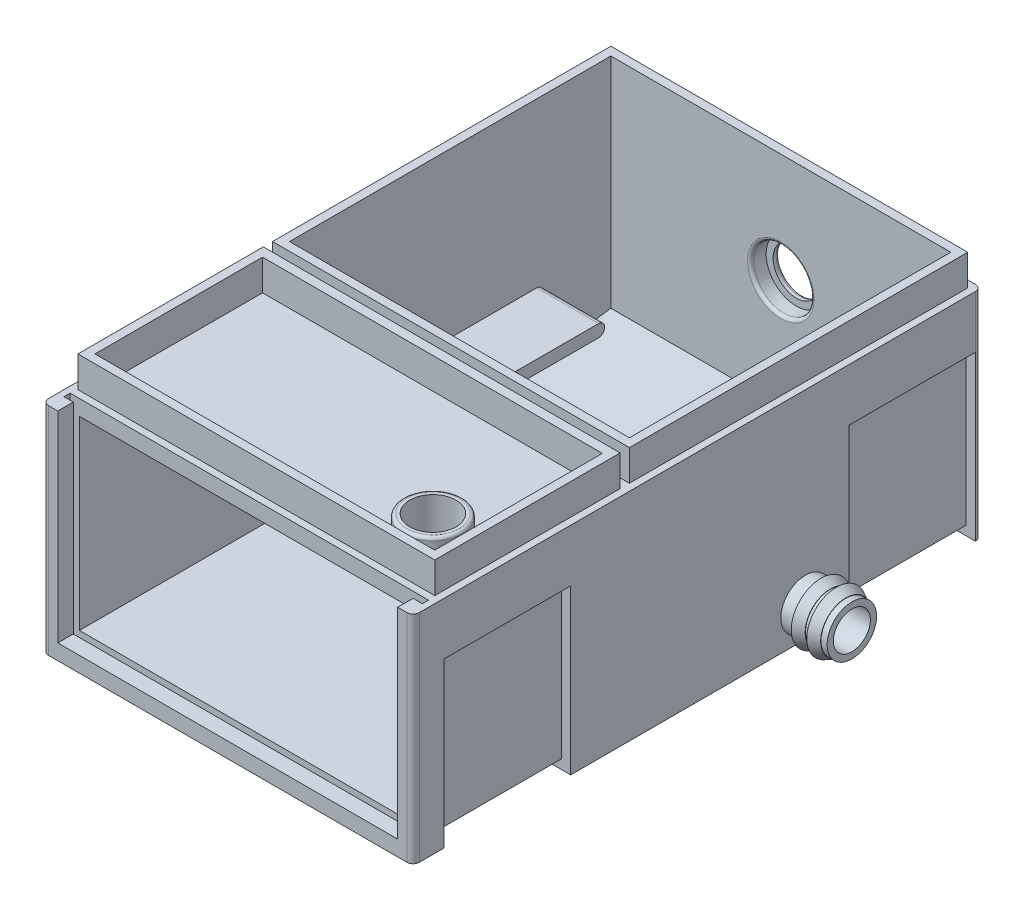
from build123d import *

# Parameters (mm, degrees)
CROQUIS2_W                 = 120
CROQUIS2_H                 = 114
SALIENTE_EXTRUIR1_DEPTH    = 10
CORTAR_EXTRUIR1_DEPTH      = 134.225372959
CORTAR_EXTRUIR1_DEPTH_BACK = 134.225372959
CROQUIS5_W                 = 120
CROQUIS5_H                 = 114
CROQUIS5_W_2               = 110
CROQUIS5_H_2               = 104
SALIENTE_EXTRUIR5_DEPTH    = 80
CROQUIS6_R                 = 8
CORTAR_EXTRUIR2_DEPTH      = 10
SALIENTE_EXTRUIR6_START    = 15
CROQUIS7_R                 = 8
CROQUIS7_R_2               = 6
SALIENTE_EXTRUIR6_DEPTH    = 20
MATRIZL1_OUTLINE_W         = 6
MATRIZL1_OUTLINE_H         = 3
CROQUIS42_R                = 6
CORTAR_EXTRUIR16_DEPTH     = 10
CROQUIS9_R                 = 7.5
CORTAR_EXTRUIR4_DEPTH      = 159.180276899
CROQUIS10_R                = 9.75
CROQUIS10_R_2              = 7.5
CORTAR_EXTRUIR5_DEPTH      = 27
SALIENTE_EXTRUIR7_DEPTH    = 20
CROQUIS13_W                = 120
CROQUIS13_H                = 114
CROQUIS13_W_2              = 115.5
CROQUIS13_H_2              = 109.5
CORTAR_EXTRUIR6_DEPTH      = 10
CROQUIS14_R                = 2.5
SALIENTE_EXTRUIR8_DEPTH    = 2
CROQUIS15_R                = 1
CORTAR_EXTRUIR7_DEPTH      = 5
CROQUIS16_W                = 120
CROQUIS16_H                = 70
CROQUIS16_W_2              = 110
CROQUIS16_H_2              = 60
SALIENTE_EXTRUIR9_DEPTH    = 70
CROQUIS17_W                = 116
CROQUIS17_H                = 2
CORTAR_EXTRUIR8_DEPTH      = 68
REDONDEO1_R                = 2
REDONDEO2_R                = 2
CROQUIS19_R                = 12.5
CROQUIS19_R_2              = 7.5
SALIENTE_EXTRUIR11_DEPTH   = 2
CORTAR_EXTRUIR9_START      = -2
CORTAR_EXTRUIR9_OUTLINE_W  = 0.990232649
CORTAR_EXTRUIR9_OUTLINE_H  = 0.145037793
CORTAR_EXTRUIR9_DEPTH      = 3
CORTAR_EXTRUIR10_DEPTH     = 2
CORTAR_EXTRUIR11_REACH     = 217.919
CROQUIS33_W                = 110
CROQUIS33_H                = 5
CROQUIS34_W                = 41
CROQUIS34_H                = 53
CORTAR_EXTRUIR12_DEPTH     = 3
CROQUIS35_W                = 20
CROQUIS35_H                = 41
CORTAR_EXTRUIR13_DEPTH     = 3
SALIENTE_EXTRUIR16_DEPTH   = 10
CROQUIS38_R                = 7.5
CORTAR_EXTRUIR15_DEPTH     = 10
SALIENTE_EXTRUIR17_START   = 10
CROQUIS39_R                = 9.5
CROQUIS39_R_2              = 7.5
SALIENTE_EXTRUIR17_DEPTH   = 10
REDONDEO3_R                = 1
REDONDEO4_R                = 1
REDONDEO5_R                = 1
CROQUIS43_W                = 115.5
CROQUIS43_H                = 3
CORTAR_EXTRUIR17_DEPTH     = 10
CROQUIS44_W                = 110
CROQUIS44_H                = 3
SALIENTE_EXTRUIR18_DEPTH   = 10


with BuildPart() as part:
    # Croquis2 → Saliente-Extruir1 (new body)
    with BuildSketch(Plane(origin=(0, 0, 0), x_dir=(1, 0, 0), z_dir=(0, 1, 0))):
        Rectangle(CROQUIS2_W, CROQUIS2_H)
    extrude(amount=SALIENTE_EXTRUIR1_DEPTH)

    # Croquis3 → Cortar-Extruir1 (cut, two sides: drawn at the far end of the back side and taken through both)
    with BuildSketch(Plane.ZY.offset(60).offset(-CORTAR_EXTRUIR1_DEPTH_BACK)):
        Polygon((-293.556980837, 43.200979767), (-57, 10), (0, 2), (57, 10), (293.556980837, 43.200979767), (293.556980837, 520.952003796), (-293.556980837, 520.952003796), align=None)
    extrude(amount=CORTAR_EXTRUIR1_DEPTH + CORTAR_EXTRUIR1_DEPTH_BACK, mode=Mode.SUBTRACT)

    # Croquis5 → Saliente-Extruir5 (add)
    with BuildSketch(Plane.XZ):
        Rectangle(CROQUIS5_W, CROQUIS5_H)
        Rectangle(CROQUIS5_W_2, CROQUIS5_H_2, mode=Mode.SUBTRACT)
    extrude(amount=-SALIENTE_EXTRUIR5_DEPTH)

    # Croquis6 → Cortar-Extruir2 (cut)
    with BuildSketch(Plane(origin=(60, 0, 0), x_dir=(0, 0, -1), z_dir=(1, 0, 0))):
        with Locations((0, 10)):
            Circle(CROQUIS6_R)
    extrude(amount=-CORTAR_EXTRUIR2_DEPTH, mode=Mode.SUBTRACT)

    # Croquis7 → Saliente-Extruir6 (add)
    with BuildSketch(Plane(origin=(60, 0, 0), x_dir=(0, 0, -1), z_dir=(1, 0, 0)).offset(SALIENTE_EXTRUIR6_START)):
        with Locations((0, 10)):
            Circle(CROQUIS7_R)
        with Locations((0, 10)):
            Circle(CROQUIS7_R_2, mode=Mode.SUBTRACT)
    extrude(amount=-SALIENTE_EXTRUIR6_DEPTH)

    # Recubrir-Lámina1: read off the stored shape, not the designer's step
    # Recubrir-Lámina1 outline → Recubrir-Lámina1 (revolve)
    with BuildSketch(Plane(origin=(0, 10, 0), x_dir=(0, 1, 0), z_dir=(0, 0, -1))):
        Polygon((8, 68), (8, 65), (9.611803399, 65), (8.111803399, 68), align=None)
    revolve(axis=Axis((0, 10, 0), (1, 0, 0)))

    # MatrizL1: read off the stored shape, not the designer's step
    # MatrizL1 outline → MatrizL1 (revolve)
    with BuildSketch(Plane(origin=(0, 10, 0), x_dir=(0, 1, 0), z_dir=(0, 0, -1))):
        with Locations((3, 71.5)):
            Rectangle(MATRIZL1_OUTLINE_W, MATRIZL1_OUTLINE_H)
        Polygon((8, 73), (8, 70), (9.611803399, 70), (8.111803399, 73), align=None)
    revolve(axis=Axis((0, 10, 0), (1, 0, 0)))

    # Croquis42 → Cortar-Extruir16 (cut)
    with BuildSketch(Plane(origin=(73, 0, 0), x_dir=(0, 0, -1), z_dir=(1, 0, 0))):
        with Locations((0, 10)):
            Circle(CROQUIS42_R)
    extrude(amount=-CORTAR_EXTRUIR16_DEPTH, mode=Mode.SUBTRACT)

    # Croquis9 → Cortar-Extruir4 (cut, through all)
    with BuildSketch(Plane.XY.offset(57)):
        with Locations((0, 44.649122807)):
            Circle(CROQUIS9_R)
    extrude(amount=-CORTAR_EXTRUIR4_DEPTH, mode=Mode.SUBTRACT)

    # Croquis10 → Cortar-Extruir5 (cut)
    with BuildSketch(Plane.XY.offset(-52)):
        with Locations((0, 44.649122807)):
            Circle(CROQUIS10_R)
        with Locations((0, 44.649122807)):
            Circle(CROQUIS10_R_2, mode=Mode.SUBTRACT)
    cortar_extruir5 = extrude(amount=-CORTAR_EXTRUIR5_DEPTH, mode=Mode.SUBTRACT)

    # Simetría1: Cortar-Extruir5 across plane
    add(cortar_extruir5.mirror(Plane.XY), mode=Mode.SUBTRACT)

    # Croquis11 → Saliente-Extruir7 (add)
    with BuildSketch(Plane.ZY.offset(-55)):
        with BuildLine():
            ThreePointArc((28, 23), (30, 25), (28, 27))
            Line((28, 27), (-28, 27))
            ThreePointArc((-28, 27), (-30, 25), (-28, 23))
            Line((-28, 23), (-8.460817995, 23))
            Line((-8.460817995, 23), (28, 23))
        make_face()
    saliente_extruir7 = extrude(amount=SALIENTE_EXTRUIR7_DEPTH)

    # Simetría2: Saliente-Extruir7 across plane
    add(saliente_extruir7.mirror(Plane(origin=(0, 0, 0), x_dir=(0, 0, 1), z_dir=(1, 0, 0))))

    # Croquis13 → Cortar-Extruir6 (cut)
    with BuildSketch(Plane(origin=(0, 80, 0), x_dir=(1, 0, 0), z_dir=(0, 1, 0))):
        Rectangle(CROQUIS13_W, CROQUIS13_H)
        Rectangle(CROQUIS13_W_2, CROQUIS13_H_2, mode=Mode.SUBTRACT)
    extrude(amount=-CORTAR_EXTRUIR6_DEPTH, mode=Mode.SUBTRACT)

    # Croquis14 → Saliente-Extruir8 (add)
    with BuildSketch(Plane.XY.offset(57)):
        with Locations(Location((-45, 60, 0), (0, 0, 180))):
            Circle(CROQUIS14_R)
        with Locations(Location((-45, 10, 0), (0, 0, 180))):
            Circle(CROQUIS14_R)
        with Locations(Location((45, 10, 0), (0, 0, 180))):
            Circle(CROQUIS14_R)
        with Locations(Location((45, 60, 0), (0, 0, 180))):
            Circle(CROQUIS14_R)
    extrude(amount=SALIENTE_EXTRUIR8_DEPTH)

    # Croquis15 → Cortar-Extruir7 (cut)
    with BuildSketch(Plane.XY.offset(59)):
        with Locations((-45, 60)):
            Circle(CROQUIS15_R)
        with Locations((-45, 10)):
            Circle(CROQUIS15_R)
        with Locations((45, 10)):
            Circle(CROQUIS15_R)
        with Locations((45, 60)):
            Circle(CROQUIS15_R)
    extrude(amount=-CORTAR_EXTRUIR7_DEPTH, mode=Mode.SUBTRACT)

    # Croquis16 → Saliente-Extruir9 (add)
    with BuildSketch(Plane.XY.offset(57)):
        with Locations((0, 35)):
            Rectangle(CROQUIS16_W, CROQUIS16_H)
        with Locations((0, 35)):
            Rectangle(CROQUIS16_W_2, CROQUIS16_H_2, mode=Mode.SUBTRACT)
    extrude(amount=SALIENTE_EXTRUIR9_DEPTH)

    # Croquis17 → Cortar-Extruir8 (cut)
    with BuildSketch(Plane(origin=(0, 70, 0), x_dir=(1, 0, 0), z_dir=(0, 1, 0))):
        with Locations((0, -121)):
            Rectangle(CROQUIS17_W, CROQUIS17_H)
    extrude(amount=-CORTAR_EXTRUIR8_DEPTH, mode=Mode.SUBTRACT)

    # Redondeo1
    redondeo1_edges = [part.edges().sort_by_distance(p)[0] for p in [
        (-60, 35, -57),
        (60, 35, -57),
    ]]
    fillet(redondeo1_edges, radius=REDONDEO1_R)

    # Redondeo2
    redondeo2_edges = [part.edges().sort_by_distance(p)[0] for p in [
        (-60, 35, 127),
        (60, 35, 127),
    ]]
    fillet(redondeo2_edges, radius=REDONDEO2_R)

    # Croquis19 → Saliente-Extruir11 (add)
    with BuildSketch(Plane(origin=(0, 0, -57), x_dir=(-1, 0, 0), z_dir=(0, 0, -1))):
        with Locations(Location((0, 44.649122807, 0), (0, 0, 180))):
            Circle(CROQUIS19_R)
        with Locations((0, 44.649122807)):
            Circle(CROQUIS19_R_2, mode=Mode.SUBTRACT)
    saliente_extruir11 = extrude(amount=SALIENTE_EXTRUIR11_DEPTH)

    # Simetría3: Saliente-Extruir11 across plane
    add(saliente_extruir11.mirror(Plane.XY))

    # Cortar-Extruir9: read off the stored shape, not the designer's step
    # Cortar-Extruir9 outline → Cortar-Extruir9 (cut)
    # profile 1 of 2: a face of its own
    with BuildSketch(Plane(origin=(0, 0, -57), x_dir=(-1, 0, 0), z_dir=(0, 0, -1)).offset(CORTAR_EXTRUIR9_START)):
        Polygon((-42.791191374, 27.157045796), (-41.105219056, 25.378799011), (-39.419246739, 23.600306815), (-39.225863014, 21.372467412), (-39.035178809, 19.144628008), (-39.090641654, 19.086465645), (-39.217273636, 18.955416268), (-39.35347664, 18.815777513), (-39.531154072, 18.634173508), (-39.745643126, 18.415267058), (-39.991299355, 18.164457203), (-40.263459952, 17.886897568), (-40.556725879, 17.58749637), (-40.865943509, 17.271898059), (-41.464009672, 16.661070533), (-41.731507463, 16.387192061), (-41.971764654, 16.141045011), (-42.179136795, 15.92778301), (-42.349206491, 15.752559686), (-42.476574706, 15.620283255), (-42.556333221, 15.536352756), (-42.583328411, 15.505676403), (-42.576702319, 15.49561456), (-42.568849173, 15.487516003), (-42.558541919, 15.477208749), (-42.546025967, 15.465429029), (-42.53179214, 15.452176845), (-42.516085847, 15.437697607), (-42.499397912, 15.422482136), (-42.481973744, 15.406530433), (-42.380619076, 15.319655004), (-40.70421778, 17.032622511), (-40.119158391, 17.626762101), (-39.856814227, 17.891805784), (-39.62072902, 18.129118045), (-39.416301809, 18.333545256), (-39.248195399, 18.500670023), (-39.121318006, 18.625093307), (-39.040577847, 18.701906893), (-39.010883138, 18.726447975), (-39.000821295, 18.670003487), (-38.99345897, 18.608650783), (-38.984624181, 18.528401445), (-38.974807748, 18.431464172), (-38.964009672, 18.320047661), (-38.952720774, 18.19660602), (-38.940941055, 18.063102535), (-38.928915925, 17.921991315), (-38.866090756, 17.136676698), (-38.793449154, 17.07139742), (-38.755165066, 17.033358744), (-38.742649114, 17.014952932), (-38.733568914, 16.99335678), (-38.727433644, 16.965870769), (-38.723752481, 16.930531611), (-38.721789195, 16.884394377), (-38.721298373, 16.825004959), (-38.721052962, 16.749909249), (-38.721052962, 16.496399875), (-38.06899642, 16.496399875), (-38.06899642, 17.027959706), (-35.655871849, 17.027959706), (-35.583475658, 16.923905519), (-35.511570288, 16.830649408), (-35.472059147, 16.788438748), (-35.429848486, 16.748927606), (-35.384692896, 16.711870573), (-35.336592375, 16.677022236), (-35.284810693, 16.644137187), (-35.229593259, 16.612970013), (-35.170449252, 16.583275304), (-35.087009574, 16.545482038), (-35.051670416, 16.532720676), (-35.016576669, 16.523149654), (-34.979765046, 16.516523562), (-34.938045207, 16.512106167), (-34.889453865, 16.509652059), (-34.83080068, 16.508670415), (-34.759631543, 16.508425005), (-34.629072988, 16.509652059), (-34.580236235, 16.512351578), (-34.538761807, 16.516768972), (-34.501950184, 16.523640475), (-34.467347259, 16.533456908), (-34.432008101, 16.546709092), (-34.393478603, 16.563887849), (-34.349059245, 16.585729412), (-34.193714197, 16.678494701), (-34.123035882, 16.733712135), (-34.057756604, 16.793837786), (-33.998121776, 16.858871652), (-33.944867628, 16.928322914), (-33.897748751, 17.001700748), (-33.857746788, 17.078514334), (-33.824861738, 17.15827285), (-33.811854965, 17.203673851), (-33.805474284, 17.232632328), (-33.799093602, 17.264535734), (-33.792958332, 17.298402427), (-33.787313883, 17.333741585), (-33.782405667, 17.369326153), (-33.777988272, 17.404665311), (-33.77430711, 17.438532004), (-33.757373763, 17.622344706), (-32.766895703, 16.57591298), (-32.416203645, 16.206324288), (-32.255214148, 16.036745413), (-32.107722247, 15.881645776), (-31.977163692, 15.744461129), (-31.866728824, 15.628381812), (-31.778871751, 15.536843577), (-31.717273636, 15.473036765), (-31.684879408, 15.440397126), (-31.59554987, 15.351067588), (-31.4964039, 15.44751404), (-31.399957448, 15.54666001), (-32.829720872, 17.054464074), (-33.334285514, 17.586760138), (-33.565707915, 17.83069849), (-33.77725204, 18.053531513), (-33.964500493, 18.25084181), (-34.122790471, 18.417475756), (-34.247949988, 18.549015954), (-34.335316239, 18.6407996), (-34.380471829, 18.687918477), (-34.50366806, 18.813568815), (-34.303167422, 20.959195595), (-34.23347075, 21.712606805), (-34.201321933, 22.055200306), (-34.172363456, 22.366135813), (-34.14659532, 22.639032642), (-34.124753757, 22.867510113), (-34.107820411, 23.044942134), (-34.096286103, 23.164948024), (-34.090641654, 23.220901691), (-34.076162416, 23.334526899), (-33.286430404, 23.334526899), (-33.286430404, 23.924003683), (-33.287412047, 24.18119422), (-33.288884512, 24.278622315), (-33.291338621, 24.357644598), (-33.29428355, 24.419488124), (-33.298210123, 24.465870769), (-33.302872929, 24.498019586), (-33.308517378, 24.517407041), (-33.315388881, 24.525751008), (-33.250109603, 24.605754935), (-33.165442871, 24.698274813), (-33.050345198, 24.820734811), (-32.908497745, 24.969699178), (-32.742845443, 25.141732161), (-32.557314865, 25.333398009), (-32.35485094, 25.54077015), (-32.138889421, 25.760412832), (-31.712365419, 26.195771623), (-31.516527587, 26.395536028), (-31.337868512, 26.578612499), (-31.179578534, 26.74107446), (-31.045584228, 26.878749929), (-30.939812165, 26.988203153), (-30.865698098, 27.06526215), (-30.827414011, 27.106245757), (-30.723605235, 27.222325073), (-30.730722149, 27.403438257), (-30.738084473, 27.587250959), (-32.242943607, 26.052942527), (-33.747557331, 24.518388684), (-33.967445423, 24.518388684), (-33.950512077, 24.743184993), (-33.938486947, 24.907119419), (-33.931370033, 24.959146512), (-33.920817368, 24.995467313), (-33.905111076, 25.01853593), (-33.882042459, 25.031297293), (-33.849893642, 25.036941742), (-33.806455927, 25.038168796), (-33.750011439, 25.037923385), (-33.669025869, 25.039886671), (-33.637122463, 25.042831601), (-33.60939104, 25.047248996), (-33.584113726, 25.053875088), (-33.560308877, 25.062955288), (-33.536504027, 25.074735008), (-33.511717535, 25.089705067), (-33.484476934, 25.108110879), (-33.355881666, 25.241614364), (-33.316125113, 25.321127469), (-33.293056496, 25.40554879), (-33.286921226, 25.49266963), (-33.297473891, 25.57979047), (-33.325450724, 25.663966381), (-33.370851725, 25.742743253), (-33.433676895, 25.81366698), (-33.564726271, 25.900296998), (-33.635895409, 25.925574313), (-33.708782421, 25.938335675), (-33.782160256, 25.938826497), (-33.854556447, 25.927292188), (-33.924743941, 25.903241928), (-33.991004862, 25.867166538), (-34.052112155, 25.818575196), (-34.105120892, 25.767775157), (-34.230771231, 25.881400365), (-34.41065736, 26.01195892), (-34.520110585, 26.072329982), (-34.641343529, 26.12901988), (-34.774110781, 26.181537795), (-34.917185288, 26.229883727), (-35.070567049, 26.273321441), (-35.233274421, 26.31185094), (-35.404571172, 26.345226811), (-35.653417741, 26.386210417), (-35.653417741, 26.548181557), (-37.368348535, 26.548181557), (-37.368348535, 26.490264604), (-37.371293465, 26.461060717), (-37.375465449, 26.450508052), (-37.382336952, 26.442164084), (-37.392153384, 26.435292581), (-37.405650979, 26.430138954), (-37.423075147, 26.425476148), (-37.445162121, 26.421549575), (-37.472402722, 26.417623002), (-37.525656869, 26.410506088), (-37.562959314, 26.405597872), (-37.605906207, 26.399708012), (-37.653025084, 26.393327331), (-37.703579712, 26.386455828), (-37.756343038, 26.379093504), (-37.810088007, 26.37197659), (-37.863587565, 26.364614265), (-37.99709105, 26.34792633), (-38.06605149, 26.341791059), (-38.136975216, 26.336637432), (-38.209616818, 26.33295627), (-38.284221707, 26.330256751), (-38.360789882, 26.328538875), (-38.439566754, 26.328048054), (-38.520552324, 26.328293464), (-38.890141016, 26.335655789), (-38.890141016, 26.101043047), (-39.035178809, 26.021529942), (-39.16745524, 25.935881567), (-39.232734517, 25.885081528), (-39.296050508, 25.830600326), (-39.355685337, 25.773665016), (-39.41065736, 25.715502653), (-39.459248702, 25.657340289), (-39.500477719, 25.600159568), (-39.532626536, 25.545432956), (-39.60281403, 25.412420293), (-39.953015267, 25.412420293), (-39.953015267, 25.074244186), (-39.747606413, 25.074244186), (-39.669074951, 25.072771721), (-39.636435312, 25.071053845), (-39.608458479, 25.068599737), (-39.585144451, 25.065654807), (-39.566493229, 25.061973645), (-39.553241045, 25.057801661), (-39.545142488, 25.052893445), (-39.542442969, 25.047739818), (-39.539988861, 25.012155249), (-39.537043931, 24.977061502), (-39.533362769, 24.931905912), (-39.528699963, 24.878160943), (-39.523300925, 24.817053649), (-39.517411066, 24.750056496), (-39.510784974, 24.678151126), (-39.50366806, 24.603055416), (-39.49164293, 24.452618585), (-39.486489303, 24.382921912), (-39.482071908, 24.318133457), (-39.478390746, 24.260216504), (-39.475691227, 24.210398108), (-39.474218762, 24.169905323), (-39.47372794, 24.139965203), (-39.474709583, 24.122295624), (-39.52158305, 24.139719792), (-39.58784397, 24.198372978), (-39.69263439, 24.300218467), (-39.843071221, 24.452618585), (-40.0467622, 24.662935655), (-40.311315061, 24.938777415), (-40.643846719, 25.287751597), (-41.051964909, 25.716975118), (-41.603648427, 26.298353345), (-41.854949104, 26.563151617), (-42.083181165, 26.80414504), (-42.283927214, 27.015934576), (-42.452033624, 27.193612008), (-42.583083001, 27.332023709), (-42.671921717, 27.426261463), (-42.713886966, 27.471171643), (-42.805670612, 27.572771721), (-42.798308288, 27.364908758), align=None)
        Polygon((-36.73666109, 20.76286694), (-36.635061012, 20.657094878), (-36.51161937, 20.528008788), (-36.369771918, 20.379044422), (-36.212218173, 20.213146709), (-36.041657655, 20.03350599), (-35.302725682, 19.252363357), (-35.123575786, 19.058488811), (-34.998661679, 18.916395948), (-34.919148574, 18.814059637), (-34.87595627, 18.740190981), (-34.859513746, 18.682519439), (-34.8607408, 18.629510702), (-34.870802643, 18.569385052), (-34.880864487, 18.522511586), (-34.887981401, 18.505578239), (-34.898043244, 18.492080644), (-34.912031661, 18.480791747), (-34.930928294, 18.470729903), (-34.956205608, 18.461158881), (-34.989090657, 18.450851627), (-35.030319675, 18.439071908), (-35.283338228, 18.329127861), (-35.392791453, 18.251578043), (-35.489483315, 18.161021451), (-35.572432171, 18.058194318), (-35.640410968, 17.945059932), (-35.692683472, 17.822354523), (-35.727777219, 17.691795968), (-35.745201387, 17.554611321), (-35.757226517, 17.366135813), (-38.527914649, 17.366135813), (-38.537485671, 17.421844068), (-38.560554288, 17.639523463), (-38.578960099, 17.844686907), (-38.599820018, 18.084453276), (-38.62117076, 18.336735597), (-38.641049036, 18.578956074), (-38.657491561, 18.789518555), (-38.668535047, 18.946090657), (-38.672707031, 19.026094584), (-38.651601701, 19.084502358), (-38.617735008, 19.131866646), (-38.562026752, 19.198372978), (-38.479568718, 19.289665802), (-38.365452687, 19.410898746), (-38.214525035, 19.567716258), (-38.022368364, 19.765517377), (-37.783829049, 20.009701141), (-37.474366008, 20.324317809), (-37.334972664, 20.464938208), (-37.209813147, 20.591079368), (-37.101096155, 20.700041771), (-37.011275795, 20.788880487), (-36.943296999, 20.855386819), (-36.899613873, 20.897106658), (-36.882925938, 20.910849664), (-36.813720087, 20.842625456), align=None, mode=Mode.SUBTRACT)
        Polygon((-38.403000543, 22.525652844), (-38.14703706, 22.255700945), (-37.832174981, 21.923414697), (-37.080972468, 21.128283648), (-37.89500015, 20.297077208), (-38.178204234, 20.008228676), (-38.305327037, 19.879878818), (-38.419688478, 19.765762788), (-38.518589038, 19.667843872), (-38.599820018, 19.588330767), (-38.660927312, 19.529922992), (-38.699947632, 19.494829245), (-38.713936049, 19.485258223), (-38.75639212, 19.953011242), (-38.799339013, 20.440397126), (-38.849893642, 21.017603369), (-38.902656967, 21.625485965), (-38.952966185, 22.204655494), (-38.995176846, 22.695967952), (-39.024135322, 23.039788507), (-39.035178809, 23.177463976), (-39.003029992, 23.151450429), (-38.953947828, 23.102613676), (-38.875416367, 23.021628107), (-38.761300336, 22.90260386), (-38.605709878, 22.739160255), align=None, mode=Mode.SUBTRACT)
        Polygon((-34.336788704, 17.76468298), (-34.294578043, 17.687623984), (-34.267337443, 17.605165949), (-34.255066902, 17.51853593), (-34.258748064, 17.429206393), (-34.27862634, 17.33840439), (-34.315192552, 17.247847798), (-34.379981008, 17.144775255), (-34.416792631, 17.103791648), (-34.457285415, 17.069434134), (-34.502195595, 17.04121189), (-34.552013991, 17.018879505), (-34.607231425, 17.00219157), (-34.668093308, 16.990902672), (-34.735581283, 16.98427658), (-34.80994076, 16.981822472), (-34.841107934, 16.982558704), (-34.869330178, 16.984767402), (-34.895343725, 16.988693975), (-34.919884807, 16.994338424), (-34.943689656, 17.001700748), (-34.967249095, 17.01127177), (-34.991544766, 17.023051489), (-35.194744923, 17.205146316), (-35.249962357, 17.321716455), (-35.274503438, 17.44638515), (-35.26885899, 17.573017132), (-35.233274421, 17.694986308), (-35.168240554, 17.805666587), (-35.0740028, 17.898922698), (-34.950561159, 17.967883138), (-34.869821, 17.987516003), (-34.822456712, 17.991687987), (-34.772392905, 17.99266963), (-34.721838277, 17.989970111), (-34.672265292, 17.984080252), (-34.625391826, 17.975245462), (-34.583181165, 17.963220332), (-34.547105775, 17.948495683), (-34.393233192, 17.834625064), align=None, mode=Mode.SUBTRACT)
        Polygon((-36.129023906, 21.69321935), (-35.958217977, 21.868442674), (-35.772932809, 22.058390647), (-35.576113333, 22.259136696), (-34.965531219, 22.879535243), (-34.765521402, 23.078563416), (-34.622937717, 23.213784777), (-34.528699963, 23.293543293), (-34.472991708, 23.325446699), (-34.446487339, 23.317593553), (-34.439615837, 23.27759159), (-34.443296999, 23.213539366), (-34.492379162, 22.665782421), (-34.541461326, 22.132013892), (-34.599132868, 21.507443361), (-34.659503929, 20.854159765), (-34.717175471, 20.234252039), (-34.766257635, 19.7093183), (-34.80086056, 19.341692895), (-34.815339798, 19.19297394), (-34.859268335, 19.219478308), (-34.914240358, 19.269542115), (-34.992280998, 19.345128647), (-35.093635666, 19.446728725), (-35.219531415, 19.575323994), (-35.370459068, 19.731650684), (-35.546909446, 19.91644503), (-35.750109603, 20.130443263), (-36.073561061, 20.473527586), (-36.218108033, 20.627400169), (-36.347439533, 20.76581187), (-36.459101455, 20.886063171), (-36.550148869, 20.98496373), (-36.618373076, 21.05981403), (-36.661074558, 21.107669139), (-36.675308386, 21.126074951), (-36.605120892, 21.20092525), (-36.52339909, 21.286082804), (-36.414682097, 21.398726369), (-36.282160256, 21.535420195), align=None, mode=Mode.SUBTRACT)
        Polygon((-38.890141016, 25.557458086), (-38.890141016, 25.412420293), (-39.047203939, 25.412420293), (-39.102175962, 25.413647347), (-39.126471633, 25.414874401), (-39.148558607, 25.416592277), (-39.16745524, 25.418800974), (-39.182916121, 25.421500493), (-39.19445043, 25.424445423), (-39.201567343, 25.427881174), (-39.204266862, 25.431807747), (-39.173835921, 25.485798127), (-39.141196282, 25.523591393), (-39.100948908, 25.564084178), (-39.056774961, 25.604331552), (-39.012110192, 25.641388586), (-38.969899531, 25.672310349), (-38.933824141, 25.69366109), (-38.907074362, 25.702495879), (-38.900939092, 25.693415679), (-38.898484984, 25.682617603), (-38.896030875, 25.668383776), (-38.894067589, 25.650714197), (-38.892349713, 25.63059051), (-38.891122659, 25.608012714), (-38.890386427, 25.583471633), align=None, mode=Mode.SUBTRACT)
        Polygon((-34.373845737, 24.519370327), (-34.399859284, 24.518388684), (-34.469801367, 24.518388684), (-34.469801367, 23.781419998), (-35.291191374, 22.960029991), (-35.291191374, 23.334526899), (-37.416694466, 23.334526899), (-37.416694466, 22.657929275), (-36.50842903, 22.657929275), (-36.187186269, 22.65645681), (-36.045829638, 22.654984345), (-35.920424711, 22.652775648), (-35.813425594, 22.650076129), (-35.726550165, 22.647131199), (-35.66225253, 22.643695447), (-35.622495978, 22.640014285), (-35.609980026, 22.636087712), (-35.651699865, 22.588232603), (-35.699554975, 22.537432563), (-35.763116376, 22.470926232), (-35.840420784, 22.390922305), (-35.9292595, 22.299138659), (-36.02816006, 22.19729317), (-36.134913765, 22.087594534), (-36.247557331, 21.971760628), (-36.880471829, 21.331238394), (-37.107476836, 21.565605725), (-37.230673066, 21.69321935), (-37.317793907, 21.784266764), (-37.418657753, 21.889793415), (-37.530319675, 22.007099786), (-37.650080154, 22.133240947), (-37.775485082, 22.265517377), (-37.903834939, 22.400984149), (-38.032675619, 22.537187152), (-38.286430404, 22.805175765), (-38.407908759, 22.933525623), (-38.522515611, 23.054513156), (-38.627796852, 23.165193435), (-38.721052962, 23.263357762), (-38.799829835, 23.346306618), (-38.861918772, 23.411095074), (-38.904620254, 23.455269022), (-39.078616524, 23.636627616), (-39.129416563, 24.288929569), (-39.148313196, 24.519861149), (-39.157393396, 24.6253878), (-39.165982775, 24.722079663), (-39.173835921, 24.807237216), (-39.180952835, 24.879387997), (-39.186597284, 24.936323306), (-39.191260089, 24.97632527), (-39.19445043, 24.996939778), (-39.204266862, 25.049948515), (-34.271754837, 25.049948515), (-34.288688184, 24.827851725), (-34.301449546, 24.668825515), (-34.307830227, 24.615571368), (-34.315437963, 24.576551048), (-34.324763574, 24.549555858), (-34.337279526, 24.532622511), (-34.353231229, 24.5232969), align=None, mode=Mode.SUBTRACT)
        Polygon((-33.600556251, 23.981675226), (-33.60031084, 23.914432661), (-33.60031084, 23.621902967), (-33.822653041, 23.629265291), (-34.047203939, 23.636627616), (-34.039841615, 23.733074067), (-34.031006825, 23.784610339), (-34.022172036, 23.808660599), (-34.008919851, 23.833692502), (-33.99051404, 23.860687692), (-33.965972958, 23.891118634), (-33.934560374, 23.926703202), (-33.895049232, 23.968668452), (-33.846703301, 24.018241437), (-33.780687791, 24.082784482), (-33.749520617, 24.111742959), (-33.720807551, 24.137756506), (-33.695039416, 24.16008889), (-33.67246162, 24.178740112), (-33.654055809, 24.192483118), (-33.640312803, 24.201317907), (-33.631723425, 24.204262837), (-33.617980419, 24.192728529), (-33.612826792, 24.177513058), (-33.608654808, 24.154935263), (-33.605464467, 24.124749732), (-33.603010359, 24.086220234), (-33.601537894, 24.038610535), align=None, mode=Mode.SUBTRACT)
        Polygon((-35.87207878, 25.412665704), (-36.293449154, 25.412420293), (-38.286430404, 25.412420293), (-38.286430404, 25.939317318), (-38.061634095, 25.980300925), (-37.897208847, 26.007786937), (-37.817695742, 26.019812067), (-37.741618389, 26.030855553), (-37.669713019, 26.040671986), (-37.603452098, 26.048770543), (-37.543571859, 26.055151224), (-37.491544766, 26.05981403), (-37.448107051, 26.062513549), (-37.370802643, 26.064967657), (-37.36368573, 25.890971387), (-37.356323405, 25.714521009), (-35.665442871, 25.714521009), (-35.653417741, 25.874038041), (-35.641392611, 26.031100964), (-35.448254297, 25.99968838), (-35.253152697, 25.96091347), (-35.155970013, 25.937108621), (-35.060996027, 25.911095074), (-34.969212381, 25.883118241), (-34.882091541, 25.853668943), (-34.800615149, 25.822992591), (-34.726501082, 25.791825417), (-34.660730983, 25.760412832), (-34.552995634, 25.693170268), (-34.498759844, 25.652922894), (-34.446978161, 25.610712233), (-34.400104695, 25.568501573), (-34.359857321, 25.528254199), (-34.328444736, 25.491442576), (-34.308075638, 25.460275402), (-34.300713314, 25.436715964), (-34.397895998, 25.426899531), (-34.519619763, 25.422972958), (-34.690425692, 25.419537206), (-34.910804607, 25.417083098), (-35.181001917, 25.415119812), (-35.501508445, 25.413647347), align=None, mode=Mode.SUBTRACT)
        with Locations((-36.511005844, 26.137486554)):
            Rectangle(CORTAR_EXTRUIR9_OUTLINE_W, CORTAR_EXTRUIR9_OUTLINE_H, mode=Mode.SUBTRACT)
    # profile 2 of 2: a face of its own
    with BuildSketch(Plane(origin=(0, 0, -57), x_dir=(-1, 0, 0), z_dir=(0, 0, -1)).offset(CORTAR_EXTRUIR9_START)):
        Polygon((-34.660485573, 17.800022138), (-34.739753267, 17.817200895), (-34.822211301, 17.813028912), (-34.904669336, 17.784070435), (-35.032528372, 17.675844264), (-35.070076227, 17.607865468), (-35.090199914, 17.534487633), (-35.092654022, 17.459146512), (-35.077438552, 17.384787035), (-35.044062681, 17.314108719), (-34.99301723, 17.250547317), (-34.924056791, 17.197047759), (-34.795952344, 17.153364634), (-34.730673066, 17.152873812), (-34.667111665, 17.165635174), (-34.607231425, 17.190912489), (-34.552995634, 17.227478701), (-34.506122168, 17.274597578), (-34.469065135, 17.331778298), (-34.443296999, 17.397548397), (-34.444278642, 17.570072202), (-34.476427459, 17.645904145), (-34.525509623, 17.711428833), (-34.588089381, 17.763701337), align=None)
    extrude(amount=CORTAR_EXTRUIR9_DEPTH, mode=Mode.SUBTRACT)

    # Croquis32 → Cortar-Extruir10 (cut)
    # profile 1 of 9: a face of its own
    with BuildSketch(Plane(origin=(0, 0, -57), x_dir=(-1, 0, 0), z_dir=(0, 0, -1))):
        Polygon((12.808243513, 23.189297205), (14.292618513, 23.189297205), (13.597506333, 18.189297205), (12.692057615, 18.189297205), (13.270983897, 22.355963872), (12.509765949, 22.355963872), align=None)
    # profile 2 of 9: a face of its own
    with BuildSketch(Plane(origin=(0, 0, -57), x_dir=(-1, 0, 0), z_dir=(0, 0, -1))):
        with BuildLine():
            add(Edge.make_bspline(
                [(9.038211462, 23.381604897), (9.076460725, 23.379374499), (9.151593504, 23.374993342), (9.260546452, 23.343519023), (9.358903782, 23.287222883), (9.44743155, 23.213901909), (9.520752524, 23.125374141), (9.577048664, 23.027016811), (9.608522983, 22.918063863), (9.61290414, 22.842931083), (9.615134538, 22.804681821)],
                knots=[0, 0, 0, 0, 1.014134371, 1.992057583, 2.975098753, 4, 5.024901247, 6.007942417, 6.985865629, 8, 8, 8, 8], degree=3))
            add(Edge.make_bspline(
                [(9.615134538, 22.804681821), (9.612919348, 22.766423915), (9.608568064, 22.691274159), (9.576792936, 22.582161914), (9.521098374, 22.483112466), (9.447345787, 22.394564714), (9.359206321, 22.320934345), (9.260239542, 22.266067249), (9.151632693, 22.234300455), (9.076473945, 22.22996558), (9.038211462, 22.227758744)],
                knots=[0, 0, 0, 0, 1.013694729, 1.991193998, 2.981551723, 4.006008661, 5.030465598, 6.008806002, 6.986305271, 8, 8, 8, 8], degree=3))
            add(Edge.make_bspline(
                [(9.038211462, 22.227758744), (8.999940536, 22.229950486), (8.924765205, 22.234255712), (8.815995274, 22.266322608), (8.716342844, 22.320588798), (8.628178966, 22.394649325), (8.554118439, 22.482813203), (8.499852249, 22.582465632), (8.467785353, 22.691235564), (8.463480127, 22.766410895), (8.461288385, 22.804681821)],
                knots=[0, 0, 0, 0, 1.01324697, 1.990314468, 2.975995575, 4, 5.024004425, 6.009685532, 6.98675303, 8, 8, 8, 8], degree=3))
            add(Edge.make_bspline(
                [(8.461288385, 22.804681821), (8.463495221, 22.842944304), (8.467830096, 22.918103051), (8.49959689, 23.026709901), (8.554463986, 23.12567668), (8.628094355, 23.213816146), (8.716642107, 23.287568733), (8.815691555, 23.343263295), (8.9248038, 23.375038423), (8.999953556, 23.379389707), (9.038211462, 23.381604897)],
                knots=[0, 0, 0, 0, 1.013694729, 1.991193998, 2.969534402, 3.993991339, 5.018448277, 6.008806002, 6.986305271, 8, 8, 8, 8], degree=3))
        make_face()
    # profile 3 of 9: a face of its own
    with BuildSketch(Plane(origin=(0, 0, -57), x_dir=(-1, 0, 0), z_dir=(0, 0, -1))):
        Polygon((8.403195436, 21.843143359), (9.308644154, 21.843143359), (8.789814026, 18.189297205), (7.884365308, 18.189297205), align=None)
    # profile 4 of 9: a face of its own
    with BuildSketch(Plane(origin=(0, 0, -57), x_dir=(-1, 0, 0), z_dir=(0, 0, -1))):
        with BuildLine():
            Line((4.300631333, 21.843143359), (5.206080051, 21.843143359))
            Line((5.206080051, 21.843143359), (5.148988705, 21.439497526))
            add(Edge.make_bspline(
                [(5.148988705, 21.439497526), (5.192525798, 21.476565924), (5.277630786, 21.549026105), (5.411533687, 21.644002164), (5.545547554, 21.726535793), (5.682418949, 21.791095289), (5.819836283, 21.843412264), (5.958768128, 21.880170756), (6.099389372, 21.903480029), (6.193570744, 21.905989309), (6.2407355, 21.907245923)],
                knots=[0, 0, 0, 0, 1.129074261, 2.207080079, 3.239806547, 4.233987332, 5.191979582, 6.140686111, 7.068880775, 8, 8, 8, 8], degree=3))
            add(Edge.make_bspline(
                [(6.2407355, 21.907245923), (6.280159431, 21.906125039), (6.357551732, 21.903924656), (6.471007549, 21.891351806), (6.57853834, 21.86800584), (6.680819801, 21.836212015), (6.776866383, 21.793355622), (6.86897638, 21.74384384), (6.954234771, 21.682735052), (7.034099042, 21.61438247), (7.105525305, 21.538275804), (7.169563863, 21.458157925), (7.222708105, 21.372154708), (7.267256455, 21.28178983), (7.301391672, 21.185985146), (7.325285075, 21.085565862), (7.339512093, 20.980502877), (7.341490047, 20.909026154), (7.342498321, 20.872590474)],
                knots=[0, 0, 0, 0, 1.118022855, 2.194767494, 3.230795032, 4.233728951, 5.225657328, 6.208555818, 7.193457995, 8.193528683, 9.184553253, 10.148487881, 11.096723343, 12.045053303, 13.000209424, 13.973718189, 14.967090947, 16, 16, 16, 16], degree=3))
            add(Edge.make_bspline(
                [(7.342498321, 20.872590474), (7.341417877, 20.833184012), (7.339025637, 20.745933116), (7.32886308, 20.601835135), (7.308737034, 20.432389345), (7.292883004, 20.310672802), (7.284405372, 20.245587269)],
                knots=[0, 0, 0, 0, 0.750743129, 1.6622403, 2.749928862, 4, 4, 4, 4], degree=3))
            Line((7.284405372, 20.245587269), (6.994942231, 18.189297205))
            Line((6.994942231, 18.189297205), (6.089493513, 18.189297205))
            Line((6.089493513, 18.189297205), (6.372947038, 20.200515154))
            add(Edge.make_bspline(
                [(6.372947038, 20.200515154), (6.379129863, 20.246231945), (6.390669086, 20.331554805), (6.40418028, 20.450378829), (6.411319382, 20.55099385), (6.413176732, 20.611832838), (6.414012744, 20.639217077)],
                knots=[0, 0, 0, 0, 1.255630561, 2.343427635, 3.254360171, 4, 4, 4, 4], degree=3))
            add(Edge.make_bspline(
                [(6.414012744, 20.639217077), (6.412588034, 20.672080228), (6.409855638, 20.735107204), (6.385976524, 20.824105461), (6.343747988, 20.900539483), (6.285378683, 20.963649109), (6.21234235, 21.013436107), (6.125650613, 21.049781797), (6.024673989, 21.070411627), (5.953039001, 21.072702811), (5.915214667, 21.07391259)],
                knots=[0, 0, 0, 0, 1.048265012, 2.010427263, 2.912347805, 3.810226671, 4.72992967, 5.714049657, 6.792984344, 8, 8, 8, 8], degree=3))
            add(Edge.make_bspline(
                [(5.915214667, 21.07391259), (5.87634473, 21.071750273), (5.797636288, 21.067371758), (5.679554792, 21.038455536), (5.563167447, 20.987688942), (5.447838256, 20.921502143), (5.338589681, 20.83802605), (5.242298913, 20.736678434), (5.158207905, 20.621515809), (5.100006159, 20.512273488), (5.059459783, 20.412190497), (5.029395382, 20.321188138), (5.001114944, 20.214952755), (4.971966616, 20.094141066), (4.944249282, 19.958066658), (4.916266892, 19.807515606), (4.889105953, 19.641559719), (4.872965114, 19.525805657), (4.864533577, 19.465338872)],
                knots=[0, 0, 0, 0, 0.882065441, 1.786110384, 2.740104157, 3.754965612, 4.797500545, 5.847687264, 6.91599857, 8.024311006, 8.646136181, 9.364850473, 10.197408591, 11.140054438, 12.184569392, 13.348033438, 14.614684545, 16, 16, 16, 16], degree=3))
            Line((4.864533577, 19.465338872), (4.687249923, 18.189297205))
            Line((4.687249923, 18.189297205), (3.781801205, 18.189297205))
            Line((3.781801205, 18.189297205), (4.300631333, 21.843143359))
        make_face()
    # profile 5 of 9: a face of its own
    with BuildSketch(Plane(origin=(0, 0, -57), x_dir=(-1, 0, 0), z_dir=(0, 0, -1))):
        with BuildLine():
            Line((2.107121718, 19.270026372), (2.891376526, 18.867382141))
            add(Edge.make_bspline(
                [(2.891376526, 18.867382141), (2.845045899, 18.811948768), (2.751921108, 18.700527411), (2.584510524, 18.556117804), (2.397209225, 18.428108822), (2.189362703, 18.319860535), (1.964898006, 18.232180945), (1.726389176, 18.171153151), (1.47645761, 18.131154975), (1.305664317, 18.127205582), (1.218700244, 18.125194641)],
                knots=[0, 0, 0, 0, 0.914244933, 1.837636877, 2.790537697, 3.784087733, 4.800790172, 5.83726639, 6.89878507, 8, 8, 8, 8], degree=3))
            add(Edge.make_bspline(
                [(1.218700244, 18.125194641), (1.150854343, 18.126347791), (1.018789243, 18.128592451), (0.826263041, 18.151624004), (0.644325817, 18.186693075), (0.473902249, 18.23826532), (0.313540197, 18.302146591), (0.165218036, 18.382501212), (0.027970487, 18.477709146), (-0.098215023, 18.58518234), (-0.210341021, 18.706056833), (-0.309199164, 18.836124579), (-0.391598033, 18.977041941), (-0.46035093, 19.126400719), (-0.511996284, 19.286308093), (-0.550433518, 19.454794358), (-0.572284875, 19.633371337), (-0.575517758, 19.755412067), (-0.577173154, 19.817902974)],
                knots=[0, 0, 0, 0, 1.167516698, 2.272623801, 3.333371772, 4.353538571, 5.333382306, 6.300396664, 7.250661637, 8.204535574, 9.148031545, 10.083792083, 11.011414416, 11.952824574, 12.908912643, 13.898953575, 14.92416002, 16, 16, 16, 16], degree=3))
            add(Edge.make_bspline(
                [(-0.577173154, 19.817902974), (-0.575691743, 19.88979323), (-0.572778191, 20.031182711), (-0.542332973, 20.238367569), (-0.495434961, 20.437350245), (-0.429702362, 20.628018327), (-0.343006409, 20.809519403), (-0.240214839, 20.983957644), (-0.115850611, 21.148205868), (0.024689159, 21.302683589), (0.178308033, 21.443409283), (0.34119075, 21.567797013), (0.512788054, 21.672662582), (0.691831855, 21.758932881), (0.879166978, 21.825932295), (1.07436219, 21.872217549), (1.277164726, 21.902793693), (1.41523544, 21.905749633), (1.485126526, 21.907245923)],
                knots=[0, 0, 0, 0, 1.05529311, 2.075487762, 3.068699193, 4.055083011, 5.031283693, 6.018666653, 7.023995929, 8.051577733, 9.082465902, 10.079966066, 11.057287041, 12.031169187, 12.994424047, 13.973330935, 14.974104677, 16, 16, 16, 16], degree=3))
            add(Edge.make_bspline(
                [(1.485126526, 21.907245923), (1.5275408, 21.906304561), (1.611148576, 21.904448932), (1.735034425, 21.894874468), (1.854915902, 21.876194755), (1.971647912, 21.852929168), (2.084265337, 21.820374182), (2.193384856, 21.780972091), (2.300132772, 21.736616141), (2.401866303, 21.682758382), (2.500423797, 21.624530388), (2.592632986, 21.557360835), (2.680858813, 21.485798553), (2.763562292, 21.407382659), (2.839472617, 21.321682842), (2.911142932, 21.230293803), (2.976871498, 21.131909444), (3.03798405, 21.028508353), (3.091482235, 20.919973079), (3.140154382, 20.809860827), (3.178689272, 20.696213845), (3.212678538, 20.58123111), (3.236631096, 20.462766946), (3.256852384, 20.34267653), (3.266056604, 20.220022123), (3.268001642, 20.1377572), (3.268980692, 20.096348487)],
                knots=[0, 0, 0, 0, 1.072343926, 2.113823519, 3.137889586, 4.13760148, 5.120645553, 6.097657508, 7.069516392, 8.039614793, 9.005002879, 9.960565349, 10.920144366, 11.87525951, 12.837543921, 13.811635494, 14.808779264, 15.826321551, 16.845367656, 17.865985152, 18.866871901, 19.876579391, 20.894541571, 21.919893521, 22.952961626, 24, 24, 24, 24], degree=3))
            add(Edge.make_bspline(
                [(3.268980692, 20.096348487), (3.268552578, 20.068962815), (3.267664096, 20.012128167), (3.261417591, 19.923204938), (3.25025272, 19.827698136), (3.240144178, 19.76178351), (3.234926205, 19.727758744)],
                knots=[0, 0, 0, 0, 0.886860648, 1.840539587, 2.885298471, 4, 4, 4, 4], degree=3))
            Line((3.234926205, 19.727758744), (0.320262744, 19.727758744))
            add(Edge.make_bspline(
                [(0.320262744, 19.727758744), (0.322175295, 19.699008731), (0.325906243, 19.642924086), (0.338501758, 19.561194354), (0.35991943, 19.484449908), (0.388172727, 19.412168844), (0.422271192, 19.34352272), (0.463227435, 19.278822964), (0.512809489, 19.220050785), (0.568187664, 19.165368715), (0.629914982, 19.116523927), (0.697721859, 19.074509342), (0.770403102, 19.037535517), (0.84975723, 19.009373258), (0.933997083, 18.985854858), (1.02394231, 18.970387872), (1.119288057, 18.959822598), (1.184948267, 18.958967519), (1.218700244, 18.958527974)],
                knots=[0, 0, 0, 0, 1.040300458, 2.029386266, 2.980027991, 3.911437883, 4.828060054, 5.744444316, 6.66911896, 7.598419554, 8.551199615, 9.504589747, 10.47513087, 11.489753162, 12.539789264, 13.630032591, 14.781741895, 16, 16, 16, 16], degree=3))
            add(Edge.make_bspline(
                [(1.218700244, 18.958527974), (1.259796606, 18.959595645), (1.341225609, 18.961711145), (1.461732582, 18.97538979), (1.578447629, 19.001119788), (1.691671421, 19.035099905), (1.801841778, 19.077813889), (1.906936244, 19.133025286), (2.010062574, 19.195706994), (2.074493094, 19.245042234), (2.107121718, 19.270026372)],
                knots=[0, 0, 0, 0, 1.027214308, 2.035339218, 3.025519259, 4.010199041, 4.987959988, 5.973205312, 6.973599434, 8, 8, 8, 8], degree=3))
        make_face()
        with BuildLine():
            add(Edge.make_bspline(
                [(2.307442231, 20.368784385), (2.289632133, 20.423813904), (2.255338506, 20.529774118), (2.180532431, 20.673618955), (2.089216989, 20.796522248), (1.981279873, 20.897601886), (1.858787824, 20.976322356), (1.724075076, 21.033257463), (1.577047671, 21.068329626), (1.474641473, 21.072017681), (1.422025564, 21.07391259)],
                knots=[0, 0, 0, 0, 1.131480038, 2.178682812, 3.159669316, 4.117470342, 5.058967564, 5.99670948, 6.970717055, 8, 8, 8, 8], degree=3))
            add(Edge.make_bspline(
                [(1.422025564, 21.07391259), (1.369387412, 21.072064012), (1.265559074, 21.068417708), (1.114707423, 21.031265583), (0.970999694, 20.974037715), (0.837544141, 20.89217177), (0.714020009, 20.791222632), (0.607997252, 20.667903028), (0.514559849, 20.527568983), (0.468925174, 20.422700376), (0.445463064, 20.368784385)],
                knots=[0, 0, 0, 0, 0.983432494, 1.939812791, 2.890131691, 3.868528921, 4.858194814, 5.863362488, 6.901492691, 8, 8, 8, 8], degree=3))
            Line((0.445463064, 20.368784385), (2.307442231, 20.368784385))
        make_face(mode=Mode.SUBTRACT)
    # profile 6 of 9: a face of its own
    with BuildSketch(Plane(origin=(0, 0, -57), x_dir=(-1, 0, 0), z_dir=(0, 0, -1))):
        with BuildLine():
            add(Edge.make_bspline(
                [(-1.218198795, 23.381604897), (-1.179949532, 23.379374499), (-1.104816752, 23.374993342), (-0.995863805, 23.343519023), (-0.897506475, 23.287222883), (-0.808978707, 23.213901909), (-0.735657733, 23.125374141), (-0.679361593, 23.027016811), (-0.647887273, 22.918063863), (-0.643506116, 22.842931083), (-0.641275718, 22.804681821)],
                knots=[0, 0, 0, 0, 1.014134371, 1.992057583, 2.975098753, 4, 5.024901247, 6.007942417, 6.985865629, 8, 8, 8, 8], degree=3))
            add(Edge.make_bspline(
                [(-0.641275718, 22.804681821), (-0.643490908, 22.766423915), (-0.647842193, 22.691274159), (-0.67961732, 22.582161914), (-0.735311882, 22.483112466), (-0.809064469, 22.394564714), (-0.897203936, 22.320934345), (-0.996170715, 22.266067249), (-1.104777564, 22.234300455), (-1.179936312, 22.22996558), (-1.218198795, 22.227758744)],
                knots=[0, 0, 0, 0, 1.013694729, 1.991193998, 2.981551723, 4.006008661, 5.030465598, 6.008806002, 6.986305271, 8, 8, 8, 8], degree=3))
            add(Edge.make_bspline(
                [(-1.218198795, 22.227758744), (-1.25646972, 22.229950486), (-1.331645052, 22.234255712), (-1.440414983, 22.266322608), (-1.540067413, 22.320588798), (-1.628231291, 22.394649325), (-1.702291817, 22.482813203), (-1.756558008, 22.582465632), (-1.788624903, 22.691235564), (-1.792930129, 22.766410895), (-1.795121872, 22.804681821)],
                knots=[0, 0, 0, 0, 1.01324697, 1.990314468, 2.975995575, 4, 5.024004425, 6.009685532, 6.98675303, 8, 8, 8, 8], degree=3))
            add(Edge.make_bspline(
                [(-1.795121872, 22.804681821), (-1.792915035, 22.842944304), (-1.78858016, 22.918103051), (-1.756813367, 23.026709901), (-1.70194627, 23.12567668), (-1.628315902, 23.213816146), (-1.539768149, 23.287568733), (-1.440718701, 23.343263295), (-1.331606456, 23.375038423), (-1.2564567, 23.379389707), (-1.218198795, 23.381604897)],
                knots=[0, 0, 0, 0, 1.013694729, 1.991193998, 2.969534402, 3.993991339, 5.018448277, 6.008806002, 6.986305271, 8, 8, 8, 8], degree=3))
        make_face()
    # profile 7 of 9: a face of its own
    with BuildSketch(Plane(origin=(0, 0, -57), x_dir=(-1, 0, 0), z_dir=(0, 0, -1))):
        Polygon((-1.85321482, 21.843143359), (-0.947766103, 21.843143359), (-1.466596231, 18.189297205), (-2.372044949, 18.189297205), align=None)
    # profile 8 of 9: a face of its own
    with BuildSketch(Plane(origin=(0, 0, -57), x_dir=(-1, 0, 0), z_dir=(0, 0, -1))):
        Polygon((-3.319560974, 23.317502333), (-2.414112256, 23.317502333), (-3.133262897, 18.189297205), (-4.038711615, 18.189297205), align=None)
    # profile 9 of 9: a face of its own
    with BuildSketch(Plane(origin=(0, 0, -57), x_dir=(-1, 0, 0), z_dir=(0, 0, -1))):
        Polygon((-6.607822192, 23.189297205), (-5.820562577, 23.189297205), (-4.551532128, 18.189297205), (-5.475009692, 18.189297205), (-5.751452, 19.279040795), (-7.70057059, 19.279040795), (-8.285506487, 18.189297205), (-9.295121872, 18.189297205), align=None)
        Polygon((-5.964793346, 20.112374128), (-6.377453603, 21.739978295), (-7.251852641, 20.112374128), align=None, mode=Mode.SUBTRACT)
    extrude(amount=-CORTAR_EXTRUIR10_DEPTH, mode=Mode.SUBTRACT)

    # Croquis33 → Cortar-Extruir11 (cut, up to next)
    with BuildSketch(Plane.XY.offset(127), mode=Mode.PRIVATE) as cortar_extruir11_sk1:
        with Locations((0, 67.5)):
            Rectangle(CROQUIS33_W, CROQUIS33_H)
    cortar_extruir11_tool1 = extrude(cortar_extruir11_sk1.sketch, amount=-CORTAR_EXTRUIR11_REACH, mode=Mode.PRIVATE) & part.part
    add(cortar_extruir11_tool1.solids().sort_by_distance((0, 67.5, 127))[0], mode=Mode.SUBTRACT)

    # Croquis34 → Cortar-Extruir12 (cut)
    with BuildSketch(Plane.ZY.offset(60)):
        with Locations((-34.5, 26.5)):
            Rectangle(CROQUIS34_W, CROQUIS34_H)
        with Locations((96.5, 26.5)):
            Rectangle(CROQUIS34_W, CROQUIS34_H)
    cortar_extruir12 = extrude(amount=-CORTAR_EXTRUIR12_DEPTH, mode=Mode.SUBTRACT)

    # Simetría4: Cortar-Extruir12 across plane
    add(cortar_extruir12.mirror(Plane(origin=(0, 0, 0), x_dir=(0, 0, 1), z_dir=(1, 0, 0))), mode=Mode.SUBTRACT)

    # Croquis35 → Cortar-Extruir13 (cut)
    with BuildSketch(Plane.XZ):
        with Locations((-50, 96.5)):
            Rectangle(CROQUIS35_W, CROQUIS35_H)
        with Locations((50, 96.5)):
            Rectangle(CROQUIS35_W, CROQUIS35_H)
        with Locations((-50, -34.5)):
            Rectangle(CROQUIS35_W, CROQUIS35_H)
        with Locations((50, -34.5)):
            Rectangle(CROQUIS35_W, CROQUIS35_H)
    extrude(amount=-CORTAR_EXTRUIR13_DEPTH, mode=Mode.SUBTRACT)

    # Croquis37 → Saliente-Extruir16 (add)
    with BuildSketch(Plane(origin=(0, 70, 0), x_dir=(1, 0, 0), z_dir=(0, 1, 0))):
        Polygon((-55, -56.75), (-55, -115), (55, -115), (55, -56.75), (55, -54.75), (57.75, -54.75), (57.75, -117.75), (-57.75, -117.75), (-57.75, -54.75), (-55, -54.75), align=None)
    extrude(amount=SALIENTE_EXTRUIR16_DEPTH)

    # Croquis38 → Cortar-Extruir15 (cut)
    with BuildSketch(Plane(origin=(0, 70, 0), x_dir=(1, 0, 0), z_dir=(0, 1, 0))):
        with Locations(Location((44.423493136, -105.030056288, 0), (0, 0, 270))):
            Circle(CROQUIS38_R)
    extrude(amount=-CORTAR_EXTRUIR15_DEPTH, mode=Mode.SUBTRACT)

    # Croquis39 → Saliente-Extruir17 (add)
    with BuildSketch(Plane(origin=(0, 70, 0), x_dir=(1, 0, 0), z_dir=(0, 1, 0)).offset(SALIENTE_EXTRUIR17_START)):
        with Locations(Location((44.423493136, -105.030056288, 0), (0, 0, 90))):
            Circle(CROQUIS39_R)
        with Locations(Location((44.423493136, -105.030056288, 0), (0, 0, 270))):
            Circle(CROQUIS39_R_2, mode=Mode.SUBTRACT)
    extrude(amount=-SALIENTE_EXTRUIR17_DEPTH)

    # Redondeo3
    redondeo3_edges = [part.edges().sort_by_distance(p)[0] for p in [
        (44.423493136, 80, 114.530056288),
    ]]
    fillet(redondeo3_edges, radius=REDONDEO3_R)

    # Redondeo4
    redondeo4_edges = [part.edges().sort_by_distance(p)[0] for p in [
        (-9.75, 44.649122807, -52),
        (-9.75, 44.649122807, 52),
        (7.5, 44.649122807, -59),
    ]]
    fillet(redondeo4_edges, radius=REDONDEO4_R)

    # Redondeo5
    redondeo5_edges = [part.edges().sort_by_distance(p)[0] for p in [
        (-12.5, 44.649122807, 57),
    ]]
    fillet(redondeo5_edges, radius=REDONDEO5_R)

    # Croquis43 → Cortar-Extruir17 (cut)
    with BuildSketch(Plane(origin=(0, 80, 0), x_dir=(1, 0, 0), z_dir=(0, 1, 0))):
        with Locations((0, -56.25)):
            Rectangle(CROQUIS43_W, CROQUIS43_H)
    extrude(amount=-CORTAR_EXTRUIR17_DEPTH, mode=Mode.SUBTRACT)

    # Croquis44 → Saliente-Extruir18 (add)
    with BuildSketch(Plane(origin=(0, 70, 0), x_dir=(1, 0, 0), z_dir=(0, 1, 0))):
        with Locations((0, -59.25)):
            Rectangle(CROQUIS44_W, CROQUIS44_H)
    extrude(amount=SALIENTE_EXTRUIR18_DEPTH)


solid = part.part
